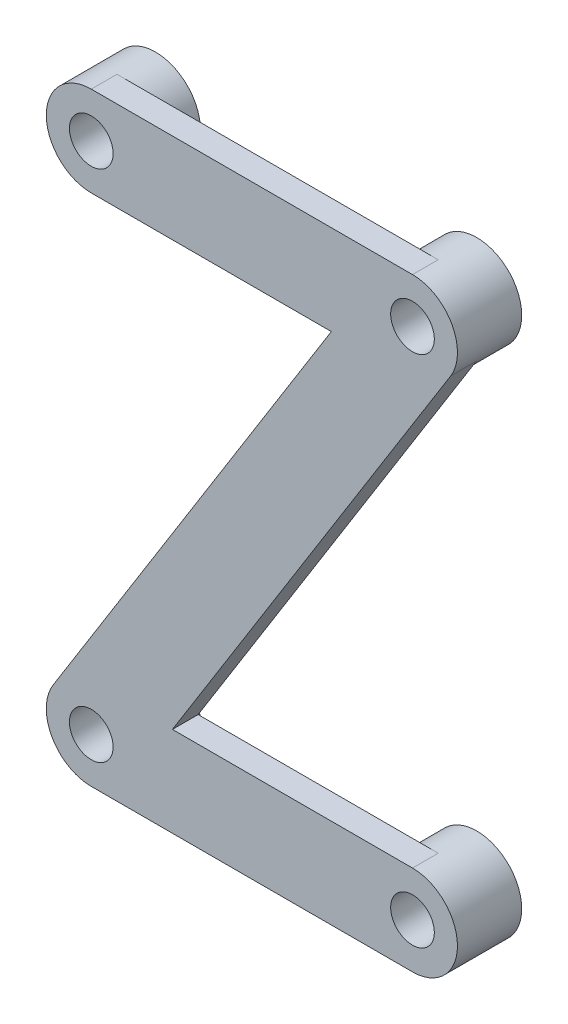
from build123d import *

# Parameters (mm, degrees)
EXTRUDE_943_DEPTH  = 2
SKETCH_1_3_R       = 3.5
SKETCH_1_3_R_2     = 1.7
EXTRUDE_1015_DEPTH = 5


with BuildPart() as part:
    # Эскиз1 → Extrude 943 (new body)
    with BuildSketch(Plane.XY):
        with BuildLine():
            Line((12.5, 23.5), (-12.5, 23.5))
            ThreePointArc((-12.5, 23.5), (-10.025126266, 22.474873734), (-9, 20))
            ThreePointArc((-9, 20), (-10.025126266, 17.525126266), (-12.5, 16.5))
            Line((-12.5, 16.5), (6.185133255, 16.5))
            Line((6.185133255, 16.5), (-15.467994064, -18.14500371))
            ThreePointArc((-15.467994064, -18.14500371), (-11.535111204, -16.635629388), (-9, -20))
            ThreePointArc((-9, -20), (-10.025126266, -22.474873734), (-12.5, -23.5))
            Line((-12.5, -23.5), (12.5, -23.5))
            ThreePointArc((12.5, -23.5), (9, -20), (12.5, -16.5))
            Line((12.5, -16.5), (-6.185133255, -16.5))
            Line((-6.185133255, -16.5), (15.467994064, 18.14500371))
            ThreePointArc((15.467994064, 18.14500371), (9.438751316, 18.303310137), (12.5, 23.5))
        make_face()
    extrude(amount=-EXTRUDE_943_DEPTH)

    # Эскиз1<3> → Extrude 1015 (add)
    # profile 1 of 4: a face of its own
    with BuildSketch(Plane.XY):
        with Locations((-12.5, 20)):
            Circle(SKETCH_1_3_R)
        with Locations((-12.5, 20)):
            Circle(SKETCH_1_3_R_2, mode=Mode.SUBTRACT)
    # profile 2 of 4: a face of its own
    with BuildSketch(Plane.XY):
        with Locations((12.5, 20)):
            Circle(SKETCH_1_3_R)
        with Locations((12.5, 20)):
            Circle(SKETCH_1_3_R_2, mode=Mode.SUBTRACT)
    # profile 3 of 4: a face of its own
    with BuildSketch(Plane.XY):
        with Locations((-12.5, -20)):
            Circle(SKETCH_1_3_R)
        with Locations((-12.5, -20)):
            Circle(SKETCH_1_3_R_2, mode=Mode.SUBTRACT)
    # profile 4 of 4: a face of its own
    with BuildSketch(Plane.XY):
        with Locations((12.5, -20)):
            Circle(SKETCH_1_3_R)
        with Locations((12.5, -20)):
            Circle(SKETCH_1_3_R_2, mode=Mode.SUBTRACT)
    extrude(amount=-EXTRUDE_1015_DEPTH)


solid = part.part
